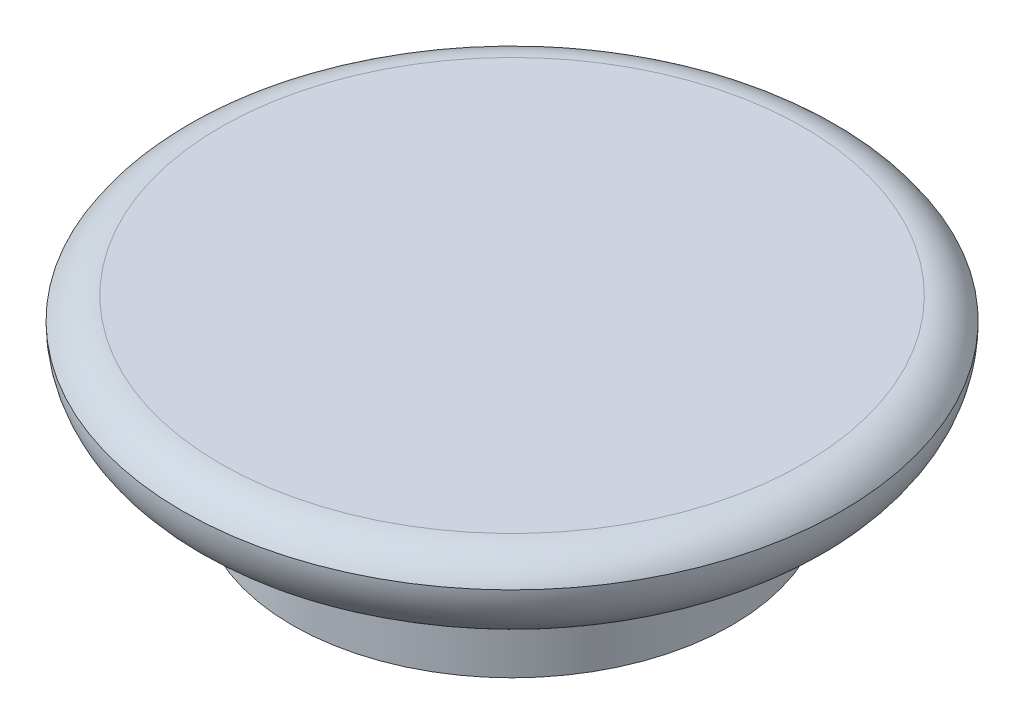
from build123d import *

# Parameters (mm, degrees)
SKETCH1_R           = 50
BOSS_EXTRUDE1_DEPTH = 20
SKETCH2_R           = 75
BOSS_EXTRUDE2_DEPTH = 20
FILLET1_R           = 15
FILLET3_R           = 10


with BuildPart() as part:
    # Sketch1 → Boss-Extrude1 (new body)
    with BuildSketch(Plane(origin=(0, 0, 0), x_dir=(1, 0, 0), z_dir=(0, 1, 0))):
        with Locations(Location((0, 0, 0), (0, 0, 270))):
            Circle(SKETCH1_R)
    extrude(amount=BOSS_EXTRUDE1_DEPTH)

    # Sketch2 → Boss-Extrude2 (add)
    with BuildSketch(Plane(origin=(0, 20, 0), x_dir=(1, 0, 0), z_dir=(0, 1, 0))):
        with Locations(Location((0, 0, 0), (0, 0, 270))):
            Circle(SKETCH2_R)
    extrude(amount=BOSS_EXTRUDE2_DEPTH)

    # Fillet1
    fillet1_edges = [part.edges().sort_by_distance(p)[0] for p in [
        (0, 20, -75),
    ]]
    fillet(fillet1_edges, radius=FILLET1_R)

    # Fillet3
    # the kernel refuses this fillet: 10 mm, written as the material it takes off along each edge
    with BuildSketch(Plane(origin=(0, 40, 0), x_dir=(0, 0, 1), z_dir=(-1, 0, 0))) as fillet3_piece_1:
        with BuildLine():
            CenterArc((66.339745962, -10), FILLET3_R, 30, 60)
            Line((66.339745962, 0), (75, 0))
            Line((75, 0), (75, -5))
        make_face()
    revolve(axis=Axis((0, 40, 0), (0, 1, 0)), mode=Mode.SUBTRACT)


solid = part.part
